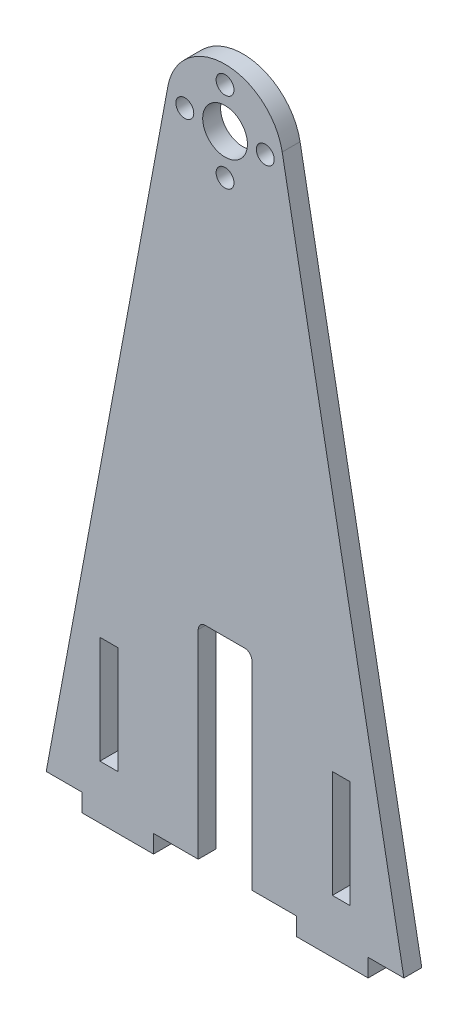
from build123d import *

# Parameters (mm, degrees)
SKETCH1_R           = 7.9375
SKETCH1_R_2         = 3.175
SKETCH1_W           = 6.35
SKETCH1_H           = 38.1
BOSS_EXTRUDE1_DEPTH = 6.35
FILLET1_R           = 2.54
FILLET2_R           = 2.54


with BuildPart() as part:
    # Sketch1 → Boss-Extrude1 (new body)
    with BuildSketch(Plane.XY):
        with BuildLine():
            Line((25.4, 0), (9.525, 0))
            Line((9.525, 0), (9.525, 73.166345412))
            Line((9.525, 73.166345412), (-9.525, 73.166345412))
            Line((-9.525, 73.166345412), (-9.525, 0))
            Line((-9.525, 0), (-25.4, 0))
            Line((-25.4, 0), (-25.4, -6.35))
            Line((-25.4, -6.35), (-50.8, -6.35))
            Line((-50.8, -6.35), (-50.8, 0))
            Line((-50.8, 0), (-63.5, 0))
            Line((-63.5, 0), (-20.289689544, 232.372917234))
            ThreePointArc((-20.289689544, 232.372917234), (0, 249.2375), (20.289689544, 232.372917234))
            Line((20.289689544, 232.372917234), (63.5, 0))
            Line((63.5, 0), (50.8, 0))
            Line((50.8, 0), (50.8, -6.35))
            Line((50.8, -6.35), (25.4, -6.35))
            Line((25.4, -6.35), (25.4, 0))
        make_face()
        with Locations((0, 228.6)):
            Circle(SKETCH1_R, mode=Mode.SUBTRACT)
        with Locations((0, 242.8875)):
            Circle(SKETCH1_R_2, mode=Mode.SUBTRACT)
        with Locations((14.2875, 228.6)):
            Circle(SKETCH1_R_2, mode=Mode.SUBTRACT)
        with Locations((0, 214.3125)):
            Circle(SKETCH1_R_2, mode=Mode.SUBTRACT)
        with Locations((-14.2875, 228.6)):
            Circle(SKETCH1_R_2, mode=Mode.SUBTRACT)
        with Locations((41.275, 31.75)):
            Rectangle(SKETCH1_W, SKETCH1_H, mode=Mode.SUBTRACT)
        with Locations((-41.275, 31.75)):
            Rectangle(SKETCH1_W, SKETCH1_H, mode=Mode.SUBTRACT)
    extrude(amount=BOSS_EXTRUDE1_DEPTH)

    # Fillet1
    fillet1_edges = [part.edges().sort_by_distance(p)[0] for p in [
        (-9.525, 73.166345412, 3.175),
    ]]
    fillet(fillet1_edges, radius=FILLET1_R)

    # Fillet2
    fillet2_edges = [part.edges().sort_by_distance(p)[0] for p in [
        (9.525, 73.166345412, 3.175),
    ]]
    fillet(fillet2_edges, radius=FILLET2_R)


solid = part.part
